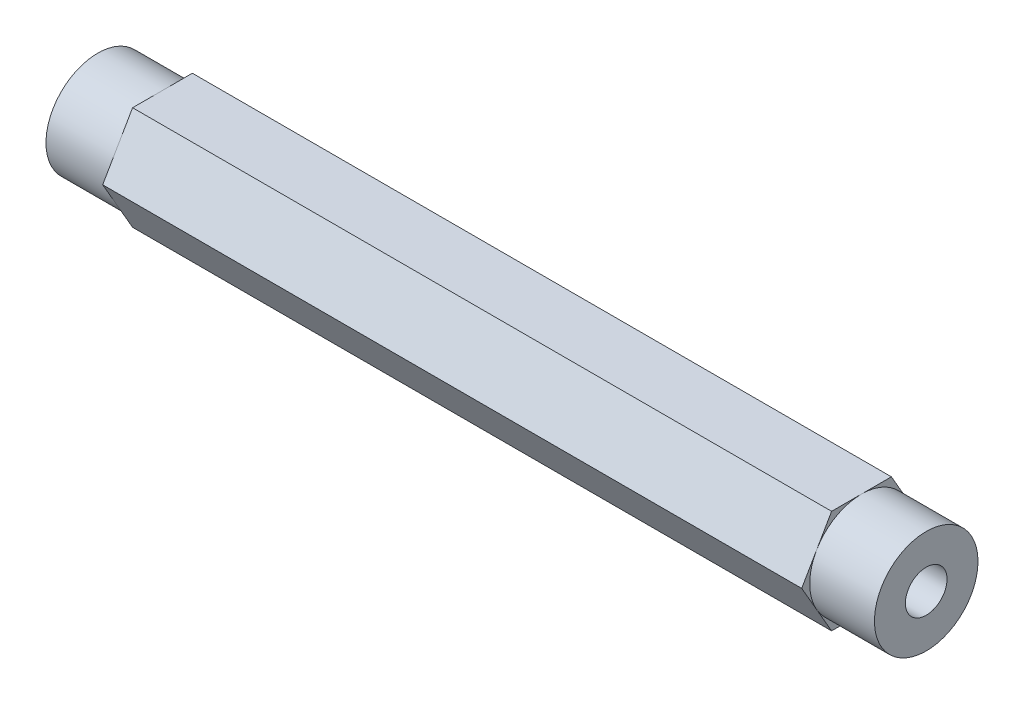
from build123d import *

# Parameters (mm, degrees)
BOSS_EXTRUDE1_DEPTH                   = 50.8
SKETCH3_R                             = 8.89
SKETCH3_R_2                           = 6.35
CUT_EXTRUDE_THIN1_DEPTH               = 7.9375
F_1_4_20_TAPPED_HOLE1_D               = 5.1054
F_1_4_20_TAPPED_HOLE1_DEPTH           = 16.51
F_1_4_20_TAPPED_HOLE1_TIP             = 1.533816902
F_1_4_20_TAPPED_HOLE1_ON_FACE_2_D     = 5.1054
F_1_4_20_TAPPED_HOLE1_ON_FACE_2_DEPTH = 16.51
F_1_4_20_TAPPED_HOLE1_ON_FACE_2_TIP   = 1.533816902


with BuildPart() as part:
    # Sketch2 → Boss-Extrude1 (new, symmetric)
    with BuildSketch(Plane(origin=(0, 0, 0), x_dir=(0, 0, -1), z_dir=(1, 0, 0))):
        Polygon((7.332348419, 0), (3.666174209, 6.35), (-3.666174209, 6.35), (-7.332348419, 0), (-3.666174209, -6.35), (3.666174209, -6.35), align=None)
    extrude(amount=BOSS_EXTRUDE1_DEPTH, both=True)

    # Sketch3 → Cut-Extrude-Thin1 (cut)
    with BuildSketch(Plane(origin=(50.8, 0, 0), x_dir=(0, 0, -1), z_dir=(1, 0, 0))):
        Circle(SKETCH3_R)
        Circle(SKETCH3_R_2, mode=Mode.SUBTRACT)
    cut_extrude_thin1 = extrude(amount=-CUT_EXTRUDE_THIN1_DEPTH, mode=Mode.SUBTRACT)

    # Mirror1: Cut-Extrude-Thin1 across plane
    add(cut_extrude_thin1.mirror(Plane(origin=(0, 0, 0), x_dir=(0, 0, 1), z_dir=(1, 0, 0))), mode=Mode.SUBTRACT)

    # 1/4-20 Tapped Hole1
    with Locations(Plane(origin=(50.8, 0, 0), x_dir=(0, 0, 1), z_dir=(1, 0, 0))):
        with Locations((0, 0)):
            Hole(F_1_4_20_TAPPED_HOLE1_D / 2, depth=F_1_4_20_TAPPED_HOLE1_DEPTH)
            with Locations((0, 0, -(F_1_4_20_TAPPED_HOLE1_DEPTH + F_1_4_20_TAPPED_HOLE1_TIP / 2))):  # 118° drill point
                Cone(0, F_1_4_20_TAPPED_HOLE1_D / 2, F_1_4_20_TAPPED_HOLE1_TIP, mode=Mode.SUBTRACT)

    # 1/4-20 Tapped Hole1 on face 2
    with Locations(Plane(origin=(-50.8, 0, 0), x_dir=(0, 0, -1), z_dir=(-1, 0, 0))):
        with Locations((0, 0)):
            Hole(F_1_4_20_TAPPED_HOLE1_ON_FACE_2_D / 2, depth=F_1_4_20_TAPPED_HOLE1_ON_FACE_2_DEPTH)
            with Locations((0, 0, -(F_1_4_20_TAPPED_HOLE1_ON_FACE_2_DEPTH + F_1_4_20_TAPPED_HOLE1_ON_FACE_2_TIP / 2))):  # 118° drill point
                Cone(0, F_1_4_20_TAPPED_HOLE1_ON_FACE_2_D / 2, F_1_4_20_TAPPED_HOLE1_ON_FACE_2_TIP, mode=Mode.SUBTRACT)


solid = part.part
